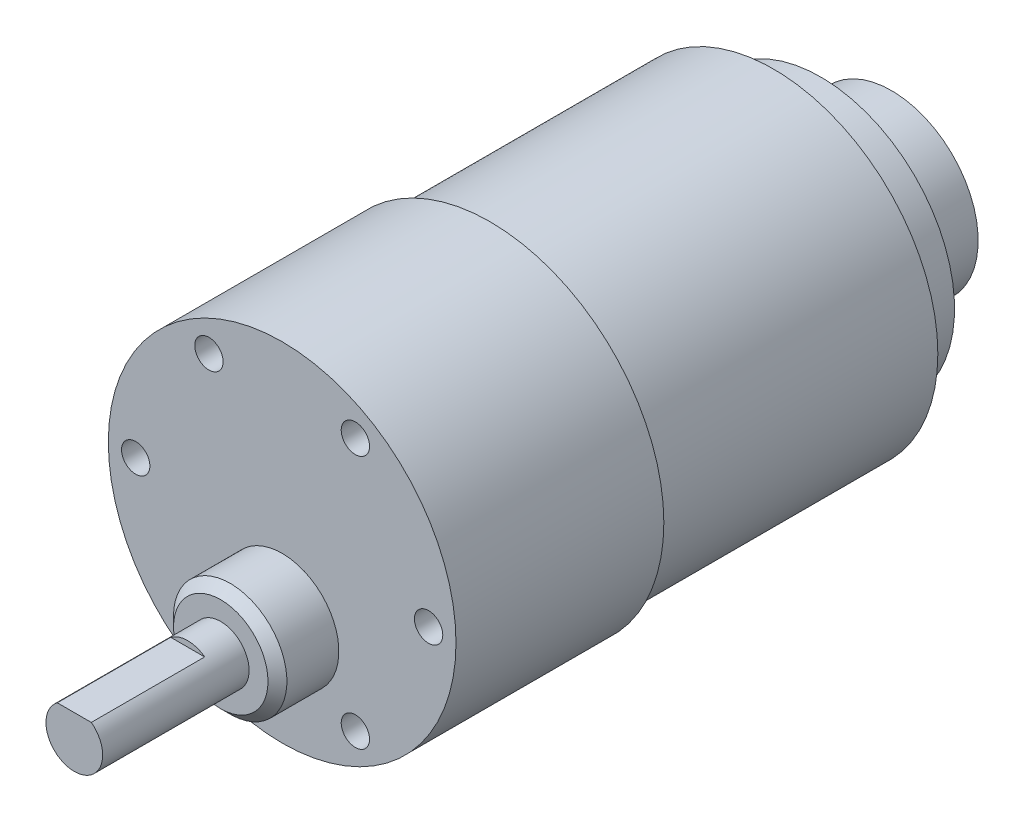
from build123d import *

# Parameters (mm, degrees)
SKETCH1_R               = 18.4
BOSS_EXTRUDE1_DEPTH     = 22
SKETCH2_R               = 17.4
BOSS_EXTRUDE2_DEPTH     = 30
SKETCH3_R               = 6
BOSS_EXTRUDE3_DEPTH     = 6.5
CHAMFER1_SIZE           = 1
SKETCH4_R               = 3
BOSS_EXTRUDE4_DEPTH     = 15.5
CUT_EXTRUDE1_DEPTH      = 15.5
CUT_EXTRUDE1_DEPTH_BACK = 15.5
SKETCH5_W               = 12
SKETCH5_H               = 0.6
SKETCH6_R               = 1.5
CUT_EXTRUDE2_DEPTH      = 5
SKETCH7_R               = 9.168264785
BOSS_EXTRUDE5_DEPTH     = 12.5
SKETCH8_R               = 14.168264785
BOSS_EXTRUDE6_DEPTH     = 5


with BuildPart() as part:
    # Sketch1 → Boss-Extrude1 (new body)
    with BuildSketch(Plane.XY):
        Circle(SKETCH1_R)
    extrude(amount=BOSS_EXTRUDE1_DEPTH)

    # Sketch2 → Boss-Extrude2 (add)
    with BuildSketch(Plane(origin=(0, 0, 0), x_dir=(-1, 0, 0), z_dir=(0, 0, -1))):
        Circle(SKETCH2_R)
    extrude(amount=BOSS_EXTRUDE2_DEPTH)

    # Sketch3 → Boss-Extrude3 (add)
    with BuildSketch(Plane.XY.offset(22)):
        with Locations((0, -7)):
            Circle(SKETCH3_R)
    extrude(amount=BOSS_EXTRUDE3_DEPTH)

    # Chamfer1
    chamfer1_edges = [part.edges().sort_by_distance(p)[0] for p in [
        (-6, -7, 28.5),
    ]]
    chamfer(chamfer1_edges, length=CHAMFER1_SIZE)

    # Sketch4 → Boss-Extrude4 (add)
    with BuildSketch(Plane.XY.offset(28.5)):
        with Locations((0, -7)):
            Circle(SKETCH4_R)
    extrude(amount=BOSS_EXTRUDE4_DEPTH)

    # Sketch5 → Cut-Extrude1 (cut, two sides: drawn at the far end of the back side and taken through both)
    with BuildSketch(Plane(origin=(0, 0, 0), x_dir=(0, 0, -1), z_dir=(1, 0, 0)).offset(-CUT_EXTRUDE1_DEPTH_BACK)):
        with Locations((-38, -4.3)):
            Rectangle(SKETCH5_W, SKETCH5_H)
    extrude(amount=CUT_EXTRUDE1_DEPTH + CUT_EXTRUDE1_DEPTH_BACK, mode=Mode.SUBTRACT)

    # Sketch6 → Cut-Extrude2 (cut)
    with BuildSketch(Plane.XY.offset(22)):
        with Locations((-7.75, 13.423393759)):
            Circle(SKETCH6_R)
        with Locations((7.75, 13.423393759)):
            Circle(SKETCH6_R)
        with Locations((15.5, 0)):
            Circle(SKETCH6_R)
        with Locations((-15.5, 0)):
            Circle(SKETCH6_R)
        with Locations((-7.75, -13.423393759)):
            Circle(SKETCH6_R)
        with Locations((7.75, -13.423393759)):
            Circle(SKETCH6_R)
    extrude(amount=-CUT_EXTRUDE2_DEPTH, mode=Mode.SUBTRACT)

    # Sketch7 → Boss-Extrude5 (add)
    with BuildSketch(Plane(origin=(0, 0, -30), x_dir=(-1, 0, 0), z_dir=(0, 0, -1))):
        Circle(SKETCH7_R)
    extrude(amount=BOSS_EXTRUDE5_DEPTH)

    # Sketch8 → Boss-Extrude6 (add)
    with BuildSketch(Plane(origin=(0, 0, -30), x_dir=(-1, 0, 0), z_dir=(0, 0, -1))):
        Circle(SKETCH8_R)
    extrude(amount=BOSS_EXTRUDE6_DEPTH)


solid = part.part
